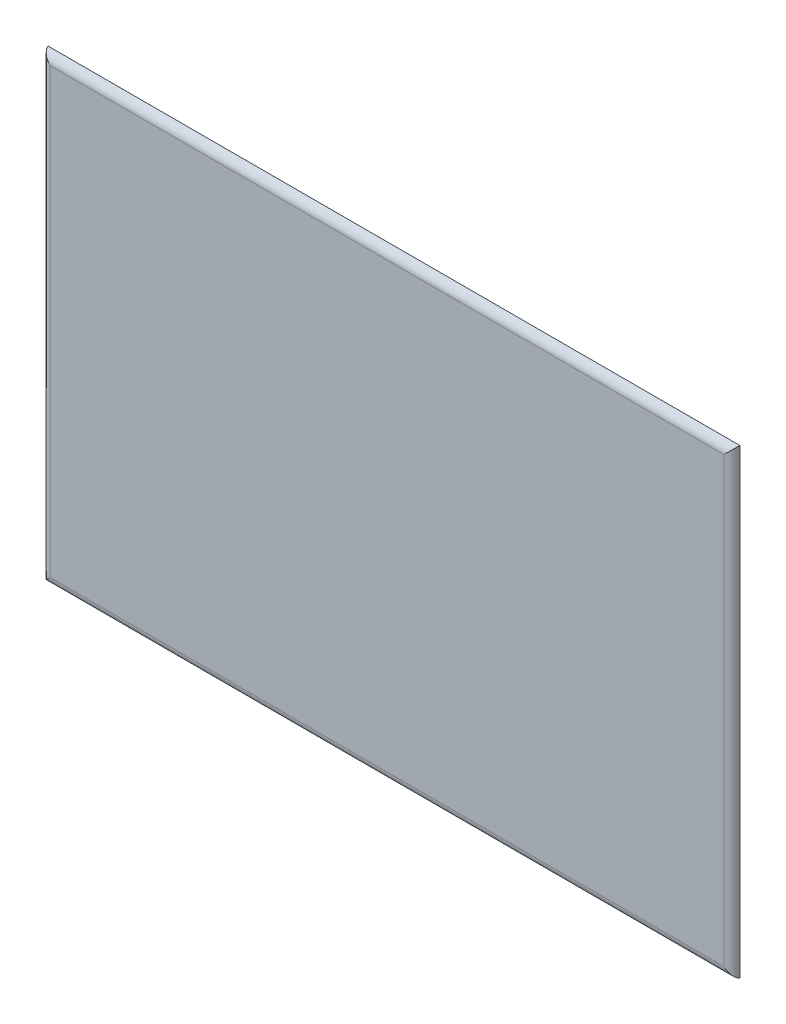
from build123d import *

# Parameters (mm, degrees)
SKETCH1_W           = 300
SKETCH1_H           = 200
BOSS_EXTRUDE1_DEPTH = 3
FILLET1_R           = 4
SKETCH2_R           = 10
BOSS_EXTRUDE3_DEPTH = 7


with BuildPart() as part:
    # Sketch1 → Boss-Extrude1 (new body)
    with BuildSketch(Plane.XY):
        with Locations((101.226150893, -82.974956672)):
            Rectangle(SKETCH1_W, SKETCH1_H)
    extrude(amount=BOSS_EXTRUDE1_DEPTH)

    # Fillet1
    # the kernel refuses this fillet: 4 mm, written as the material it takes off along each edge
    with BuildSketch(Plane(origin=(260.908609258, -182.974956672, 3), x_dir=(0, 0, -1), z_dir=(-1, 0, 0)), Plane(origin=(-58.456307473, 17.025043328, 3), x_dir=(0, 0, -1), z_dir=(1, 0, 0))) as fillet1_piece_1:
        with BuildLine():
            CenterArc((4, -3.872983346), FILLET1_R, 104.477512186, 75.522487814)
            Line((0, -3.872983346), (-0.08, -3.872983346))
            Line((-0.08, -3.872983346), (-0.08, 0))
            Line((-0.08, 0), (0, 0.08))
            ThreePointArc((0, 0.08), (1.5, 0.08), (2.98, 0.077459667))
            Line((2.98, 0.077459667), (3, 0))
        make_face()
    extrude(amount=319.364916731, mode=Mode.SUBTRACT)
    with BuildSketch(Plane(origin=(-48.773849107, -192.657415038, 3), x_dir=(0, 0, -1), z_dir=(0, 1, 0)), Plane(origin=(251.226150893, 26.707501693, 3), x_dir=(0, 0, -1), z_dir=(0, -1, 0))) as fillet1_piece_2:
        with BuildLine():
            CenterArc((4, -3.872983346), FILLET1_R, 104.477512186, 75.522487814)
            Line((0, -3.872983346), (-0.08, -3.872983346))
            Line((-0.08, -3.872983346), (-0.08, 0))
            Line((-0.08, 0), (0, 0.08))
            ThreePointArc((0, 0.08), (1.5, 0.08), (2.98, 0.077459667))
            Line((2.98, 0.077459667), (3, 0))
        make_face()
    extrude(amount=219.364916731, mode=Mode.SUBTRACT)

    # Sketch2 → Boss-Extrude3 (add)
    with BuildSketch(Plane.XY):
        with Locations((0, -16.401709137)):
            Circle(SKETCH2_R)
        with Locations((40, -16.401709137)):
            Circle(SKETCH2_R)
        with Locations((80, -16.401709137)):
            Circle(SKETCH2_R)
        with Locations((120, -16.401709137)):
            Circle(SKETCH2_R)
        with Locations((160, -16.401709137)):
            Circle(SKETCH2_R)
        with Locations((200, -16.401709137)):
            Circle(SKETCH2_R)
        with Locations((200, -66.62017199)):
            Circle(SKETCH2_R)
        with Locations((160, -66.62017199)):
            Circle(SKETCH2_R)
        with Locations((120, -66.62017199)):
            Circle(SKETCH2_R)
        with Locations((80, -66.62017199)):
            Circle(SKETCH2_R)
        with Locations((40, -66.62017199)):
            Circle(SKETCH2_R)
        with Locations((0, -66.62017199)):
            Circle(SKETCH2_R)
        with Locations((200, -121.667333194)):
            Circle(SKETCH2_R)
        with Locations((160, -121.667333194)):
            Circle(SKETCH2_R)
        with Locations((120, -121.667333194)):
            Circle(SKETCH2_R)
        with Locations((80, -121.667333194)):
            Circle(SKETCH2_R)
        with Locations((40, -121.667333194)):
            Circle(SKETCH2_R)
        with Locations((0, -121.667333194)):
            Circle(SKETCH2_R)
        with Locations((200, -155.468221653)):
            Circle(SKETCH2_R)
        with Locations((160, -155.468221653)):
            Circle(SKETCH2_R)
        with Locations((120, -155.468221653)):
            Circle(SKETCH2_R)
        with Locations((80, -155.468221653)):
            Circle(SKETCH2_R)
        with Locations((40, -155.468221653)):
            Circle(SKETCH2_R)
        with Locations((0, -155.468221653)):
            Circle(SKETCH2_R)
    extrude(amount=-BOSS_EXTRUDE3_DEPTH)


solid = part.part
